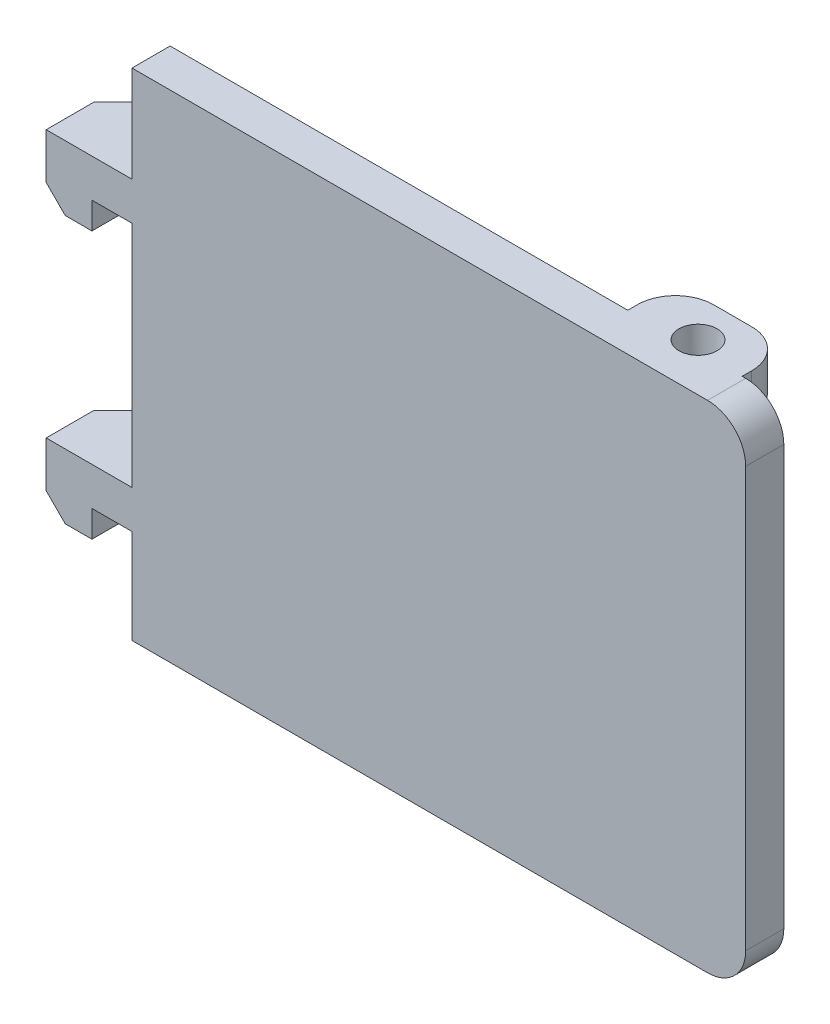
from build123d import *

# Parameters (mm, degrees)
SKETCH_2_W          = 32.183544672
SKETCH_2_H          = 26
EXTRUDE_1_DEPTH     = 2
FILLET_1_R          = 2
SKETCH_5_W          = 6
SKETCH_5_H          = 2
EXTRUDE_2_DEPTH     = 2.5
FILLET_2_R          = 2
SKETCH_6_R          = 1
CUT_EXTRUDE_3_DEPTH = 4
CUT_EXTRUDE_3_DRAFT = -2
SKETCH_7_R          = 1
CUT_EXTRUDE_4_DEPTH = 4
CUT_EXTRUDE_4_DRAFT = -2
SKETCH_8_W          = 4.5
SKETCH_8_H          = 2
EXTRUDE_3_DEPTH     = 2
SKETCH_10_W         = 2.4
SKETCH_10_H         = 1.4
EXTRUDE_4_DEPTH     = 2
EXTRUDE_4_2_DEPTH   = 2
SKETCH_11_W         = 8.5
SKETCH_11_H         = 2
EXTRUDE_5_DEPTH     = 2.5
CHAMFER_1_SIZE      = 2
CHAMFER_2_SIZE      = 1


with BuildPart() as part:
    # 草图2 → 凸台-拉伸1 (new body)
    with BuildSketch(Plane.XY):
        with Locations((-0.901029093, -19.434236018)):
            Rectangle(SKETCH_2_W, SKETCH_2_H)
    extrude(amount=EXTRUDE_1_DEPTH)

    # 圆角1
    fillet_1_edges = [part.edges().sort_by_distance(p)[0] for p in [
        (15.190743243, -32.434236018, 1),
        (15.190743243, -6.434236018, 1),
    ]]
    fillet(fillet_1_edges, radius=FILLET_1_R)

    # 草图5 → 凸台-拉伸2 (add)
    with BuildSketch(Plane(origin=(0, 0, 0), x_dir=(-1, 0, 0), z_dir=(0, 0, -1))):
        with Locations((-10.007198571, -7.434236018)):
            Rectangle(SKETCH_5_W, SKETCH_5_H)
        with Locations((-10.007198571, -31.434236018)):
            Rectangle(SKETCH_5_W, SKETCH_5_H)
    extrude(amount=EXTRUDE_2_DEPTH)

    # 圆角2
    fillet_2_edges = [part.edges().sort_by_distance(p)[0] for p in [
        (7.007198571, -7.434236018, -2.5),
        (13.007198571, -7.434236018, -2.5),
        (7.007198571, -31.434236018, -2.5),
        (13.007198571, -31.434236018, -2.5),
    ]]
    fillet(fillet_2_edges, radius=FILLET_2_R)


with BuildPart() as cut_extrude_3_tool:
    # 草图6 → 切除-拉伸3 (with draft: the straight prism first)
    with BuildSketch(Plane.XZ.offset(32.434236018)):
        with Locations((10.190743244, -0.5)):
            Circle(SKETCH_6_R)
    extrude(amount=-CUT_EXTRUDE_3_DEPTH)
    # 切除-拉伸3: the draft: its side faces are tilted about the plane it starts from
    cut_extrude_3_sides = [cut_extrude_3_tool.faces().sort_by_distance(p)[0] for p in [
        (9.190743243, -30.434236018, -0.5),
    ]]
    draft(cut_extrude_3_sides, Plane.XZ.offset(32.434236018), CUT_EXTRUDE_3_DRAFT)


with BuildPart() as part_1:
    add(part.part)

    # 切除-拉伸3: cut by cut_extrude_3_tool
    add(cut_extrude_3_tool.part, mode=Mode.SUBTRACT)


with BuildPart() as cut_extrude_4_tool:
    # 草图7 → 切除-拉伸4 (with draft: the straight prism first)
    with BuildSketch(Plane(origin=(0, -6.434236018, 0), x_dir=(1, 0, 0), z_dir=(0, 1, 0))):
        with Locations((10.190743243, 0.5)):
            Circle(SKETCH_7_R)
    extrude(amount=-CUT_EXTRUDE_4_DEPTH)
    # 切除-拉伸4: the draft: its side faces are tilted about the plane it starts from
    cut_extrude_4_sides = [cut_extrude_4_tool.faces().sort_by_distance(p)[0] for p in [
        (9.190743243, -8.434236018, -0.5),
    ]]
    draft(cut_extrude_4_sides, Plane(origin=(0, -6.434236018, 0), x_dir=(1, 0, 0), z_dir=(0, 1, 0)), CUT_EXTRUDE_4_DRAFT)


with BuildPart() as part_2:
    add(part_1.part)

    # 切除-拉伸4: cut by cut_extrude_4_tool
    add(cut_extrude_4_tool.part, mode=Mode.SUBTRACT)

    # 草图8 → 凸台-拉伸3 (add)
    with BuildSketch(Plane(origin=(0, 0, 0), x_dir=(-1, 0, 0), z_dir=(0, 0, -1))):
        with Locations((19.242801429, -12.484236018)):
            Rectangle(SKETCH_8_W, SKETCH_8_H)
        with Locations((19.242801429, -26.484236018)):
            Rectangle(SKETCH_8_W, SKETCH_8_H)
    extrude(amount=-EXTRUDE_3_DEPTH)



with BuildPart() as body_2:
    # 草图10 → 凸台-拉伸4 (new body)
    with BuildSketch(Plane(origin=(0, 0, 0), x_dir=(-1, 0, 0), z_dir=(0, 0, -1))):
        with Locations((20.292801429, -14.184236018)):
            Rectangle(SKETCH_10_W, SKETCH_10_H)
    extrude(amount=-EXTRUDE_4_DEPTH)


with BuildPart() as body_3:
    # 草图10 → Extrude 4 2 (new body)
    with BuildSketch(Plane(origin=(0, 0, 0), x_dir=(-1, 0, 0), z_dir=(0, 0, -1))):
        with Locations((20.292801429, -28.184236018)):
            Rectangle(SKETCH_10_W, SKETCH_10_H)
    extrude(amount=-EXTRUDE_4_2_DEPTH)


with BuildPart() as part_3:
    add(part_2.part)

    add(body_2.part)  # 凸台-拉伸5 merges body 2

    add(body_3.part)  # 凸台-拉伸5 merges body 3
    # 草图11 → 凸台-拉伸5 (add)
    with BuildSketch(Plane(origin=(0, 0, 0), x_dir=(-1, 0, 0), z_dir=(0, 0, -1))):
        with Locations((17.242801429, -12.484236018)):
            Rectangle(SKETCH_11_W, SKETCH_11_H)
        with Locations((17.242801429, -26.484236018)):
            Rectangle(SKETCH_11_W, SKETCH_11_H)
    extrude(amount=EXTRUDE_5_DEPTH)

    # 倒角1
    chamfer_1_edges = [part_3.edges().sort_by_distance(p)[0] for p in [
        (-21.492801429, -12.484236018, -2.5),
        (-21.492801429, -26.484236018, -2.5),
        (-12.992801429, -26.484236018, -2.5),
        (-12.992801429, -12.484236018, -2.5),
    ]]
    chamfer(chamfer_1_edges, length=CHAMFER_1_SIZE)

    # 倒角2
    chamfer_2_edges = [part_3.edges().sort_by_distance(p)[0] for p in [
        (-21.492801429, -14.884236018, 1),
        (-21.492801429, -28.884236018, 1),
    ]]
    chamfer(chamfer_2_edges, length=CHAMFER_2_SIZE)


solid = part_3.part
